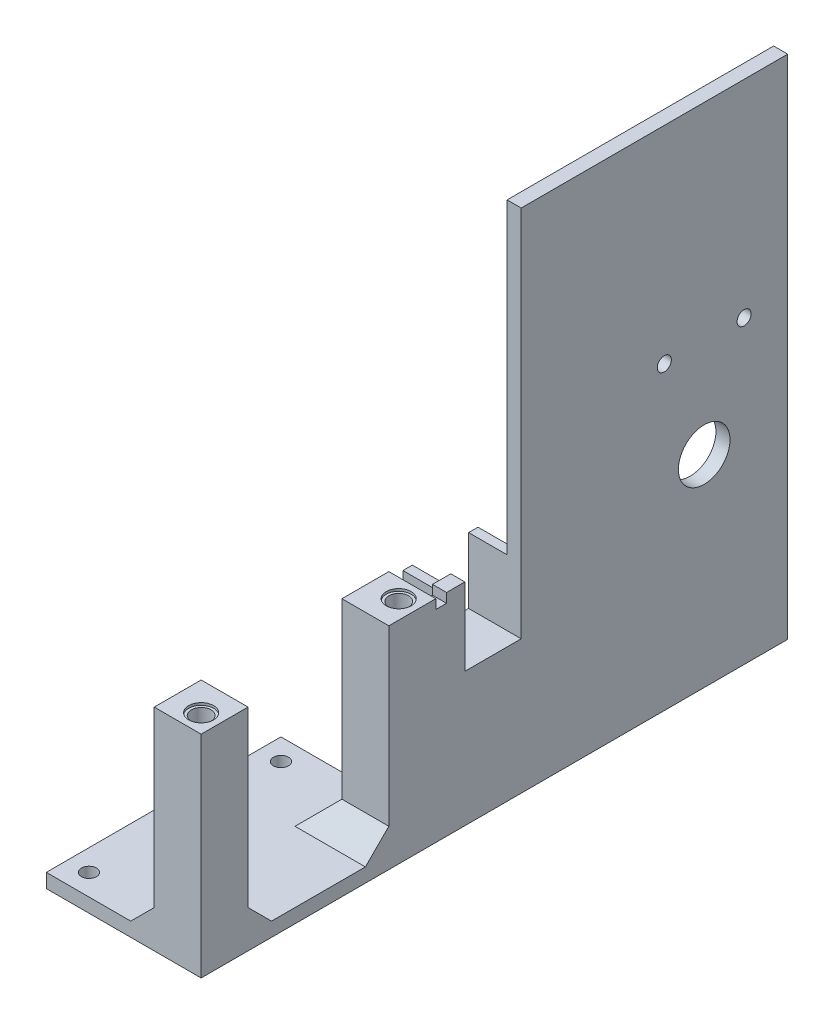
from build123d import *

# Parameters (mm, degrees)
SKETCH1_R           = 1.6
BOSS_EXTRUDE1_DEPTH = 3
SKETCH2_W           = 10
SKETCH2_H           = 10
BOSS_EXTRUDE2_DEPTH = 42
CHAMFER1_SIZE       = 5
SKETCH3_R           = 2.1
CUT_EXTRUDE1_DEPTH  = 52
SKETCH4_R           = 2.65
CUT_EXTRUDE2_DEPTH  = 0.5
SKETCH5_W           = 3
SKETCH5_H           = 43
BOSS_EXTRUDE3_DEPTH = 75
SKETCH6_W           = 3
SKETCH6_H           = 72.7
BOSS_EXTRUDE4_DEPTH = 2
SKETCH7_W           = 3
SKETCH7_H           = 68.8
BOSS_EXTRUDE5_DEPTH = 3
BOSS_EXTRUDE7_DEPTH = 8.2
SKETCH9_W           = 12
SKETCH9_H           = 19.5
CUT_EXTRUDE3_DEPTH  = 8.5
SKETCH10_W          = 3
SKETCH10_H          = 56.8
BOSS_EXTRUDE8_DEPTH = 15
SKETCH13_W          = 3
SKETCH13_H          = 56.8
BOSS_EXTRUDE9_DEPTH = 45
SKETCH14_R          = 1.5
SKETCH14_R_2        = 5.5
CUT_EXTRUDE4_DEPTH  = 10
CAVITY2_START       = 23.487603306
CAVITY2_OUTLINE_R   = 2
CAVITY2_DEPTH       = 2


# Read off the part's stored shape, not the designer's step: Cavity2
with BuildPart() as part:
    # Sketch1 → Boss-Extrude1 (new body)
    with BuildSketch(Plane(origin=(0, 0, 0), x_dir=(1, 0, 0), z_dir=(0, 1, 0))):
        Polygon((-6.512396694, 9.685950413), (1.487603306, 9.685950413), (26.487603306, 9.685950413), (26.487603306, -40.314049587), (1.487603306, -40.314049587), (-6.512396694, -40.314049587), align=None)
        with Locations(Location((-1.962396694, -35.764049587, 0), (0, 0, 270))):
            Circle(SKETCH1_R, mode=Mode.SUBTRACT)
        with Locations(Location((-1.962396694, 5.135950413, 0), (0, 0, 270))):
            Circle(SKETCH1_R, mode=Mode.SUBTRACT)
    extrude(amount=BOSS_EXTRUDE1_DEPTH)

    # Sketch2 → Boss-Extrude2 (add)
    with BuildSketch(Plane(origin=(0, 3, 0), x_dir=(1, 0, 0), z_dir=(0, 1, 0))):
        with Locations((21.487603306, -35.314049587)):
            Rectangle(SKETCH2_W, SKETCH2_H)
        with Locations((21.487603306, 4.685950413)):
            Rectangle(SKETCH2_W, SKETCH2_H)
    extrude(amount=BOSS_EXTRUDE2_DEPTH)

    # Chamfer1
    chamfer1_edges = [part.edges().sort_by_distance(p)[0] for p in [
        (21.487603306, 3, 30.314049587),
        (16.487603306, 3, 35.314049587),
        (16.487603306, 3, -4.685950413),
        (21.487603306, 3, 0.314049587),
    ]]
    chamfer(chamfer1_edges, length=CHAMFER1_SIZE)

    # Sketch3 → Cut-Extrude1 (cut)
    with BuildSketch(Plane(origin=(0, 45, 0), x_dir=(1, 0, 0), z_dir=(0, 1, 0))):
        with Locations(Location((22.537603306, -36.364049587, 0), (0, 0, 270))):
            Circle(SKETCH3_R)
        with Locations(Location((22.537603306, 5.735950413, 0), (0, 0, 270))):
            Circle(SKETCH3_R)
    extrude(amount=-CUT_EXTRUDE1_DEPTH, mode=Mode.SUBTRACT)

    # Sketch4 → Cut-Extrude2 (cut)
    with BuildSketch(Plane(origin=(0, 45, 0), x_dir=(1, 0, 0), z_dir=(0, 1, 0))):
        with Locations(Location((22.537603306, -36.364049587, 0), (0, 0, 270))):
            Circle(SKETCH4_R)
        with Locations(Location((22.537603306, 5.735950413, 0), (0, 0, 270))):
            Circle(SKETCH4_R)
    cut_extrude2 = extrude(amount=-CUT_EXTRUDE2_DEPTH, mode=Mode.SUBTRACT)

    # Mirror1: Cut-Extrude2 across plane
    add(cut_extrude2.mirror(Plane(origin=(0, 22.5, 0), x_dir=(0, 0, 1), z_dir=(0, -1, 0))), mode=Mode.SUBTRACT)

    # Sketch5 → Boss-Extrude3 (add)
    with BuildSketch(Plane(origin=(0, 0, -9.685950413), x_dir=(-1, 0, 0), z_dir=(0, 0, -1))):
        with Locations((-24.987603306, 21.5)):
            Rectangle(SKETCH5_W, SKETCH5_H)
    extrude(amount=BOSS_EXTRUDE3_DEPTH)

    # Sketch6 → Boss-Extrude4 (add)
    with BuildSketch(Plane(origin=(0, 43, 0), x_dir=(1, 0, 0), z_dir=(0, 1, 0))):
        with Locations((24.987603306, 48.335950413)):
            Rectangle(SKETCH6_W, SKETCH6_H)
    extrude(amount=BOSS_EXTRUDE4_DEPTH)

    # Sketch7 → Boss-Extrude5 (add)
    with BuildSketch(Plane(origin=(0, 45, 0), x_dir=(1, 0, 0), z_dir=(0, 1, 0))):
        with Locations((24.987603306, 50.285950413)):
            Rectangle(SKETCH7_W, SKETCH7_H)
    extrude(amount=BOSS_EXTRUDE5_DEPTH)

    # Sketch8 → Boss-Extrude7 (add)
    with BuildSketch(Plane.ZY.offset(-23.487603306)):
        Polygon((-27.885950413, 24.5), (-27.885950413, 28.5), (-27.885950413, 42.5), (-29.885950413, 42.5), (-29.885950413, 22.5), (-27.885950413, 22.5), align=None)
        with BuildLine():
            Line((-15.885950413, 24.5), (-15.885950413, 28.5))
            Line((-15.885950413, 28.5), (-27.885950413, 28.5))
            Line((-27.885950413, 28.5), (-27.885950413, 24.5))
            Line((-27.885950413, 24.5), (-22.885950413, 24.5))
            ThreePointArc((-22.885950413, 24.5), (-21.885950413, 25.5), (-20.885950413, 24.5))
            Line((-20.885950413, 24.5), (-15.885950413, 24.5))
        make_face()
        with BuildLine():
            Line((-15.885950413, 22.5), (-15.885950413, 24.5))
            Line((-15.885950413, 24.5), (-20.885950413, 24.5))
            ThreePointArc((-20.885950413, 24.5), (-21.885950413, 23.5), (-22.885950413, 24.5))
            Line((-22.885950413, 24.5), (-27.885950413, 24.5))
            Line((-27.885950413, 24.5), (-27.885950413, 22.5))
            Line((-27.885950413, 22.5), (-15.885950413, 22.5))
        make_face()
        Polygon((-15.885950413, 42.5), (-15.885950413, 28.5), (-15.885950413, 24.5), (-15.885950413, 22.5), (-13.885950413, 22.5), (-13.885950413, 42.5), align=None)
    extrude(amount=BOSS_EXTRUDE7_DEPTH)

    # Sketch9 → Cut-Extrude3 (cut)
    with BuildSketch(Plane.ZY.offset(-23.487603306)):
        with Locations((-21.885950413, 38.25)):
            Rectangle(SKETCH9_W, SKETCH9_H)
    extrude(amount=-CUT_EXTRUDE3_DEPTH, mode=Mode.SUBTRACT)

    # Sketch10 → Boss-Extrude8 (add)
    with BuildSketch(Plane(origin=(0, 48, 0), x_dir=(1, 0, 0), z_dir=(0, 1, 0))):
        with Locations((24.987603306, 56.285950413)):
            Rectangle(SKETCH10_W, SKETCH10_H)
    extrude(amount=BOSS_EXTRUDE8_DEPTH)

    # Sketch13 → Boss-Extrude9 (add)
    with BuildSketch(Plane(origin=(0, 63, 0), x_dir=(1, 0, 0), z_dir=(0, 1, 0))):
        with Locations((24.987603306, 56.285950413)):
            Rectangle(SKETCH13_W, SKETCH13_H)
    extrude(amount=BOSS_EXTRUDE9_DEPTH)

    # Sketch14 → Cut-Extrude4 (cut)
    with BuildSketch(Plane.ZY.offset(-23.487603306)):
        with Locations(Location((-58.385950413, 64, 0), (0, 0, 270))):
            Circle(SKETCH14_R)
        with Locations(Location((-75.385950413, 64, 0), (0, 0, 270))):
            Circle(SKETCH14_R)
        with Locations(Location((-66.885950413, 43, 0), (0, 0, 270))):
            Circle(SKETCH14_R_2)
    extrude(amount=-CUT_EXTRUDE4_DEPTH, mode=Mode.SUBTRACT)

    # Cavity2 outline → Cavity2 (cut)
    with BuildSketch(Plane.YZ.offset(CAVITY2_START)):
        with Locations((54, -66.885950413)):
            Circle(CAVITY2_OUTLINE_R)
    extrude(amount=CAVITY2_DEPTH, mode=Mode.SUBTRACT)


solid = part.part
